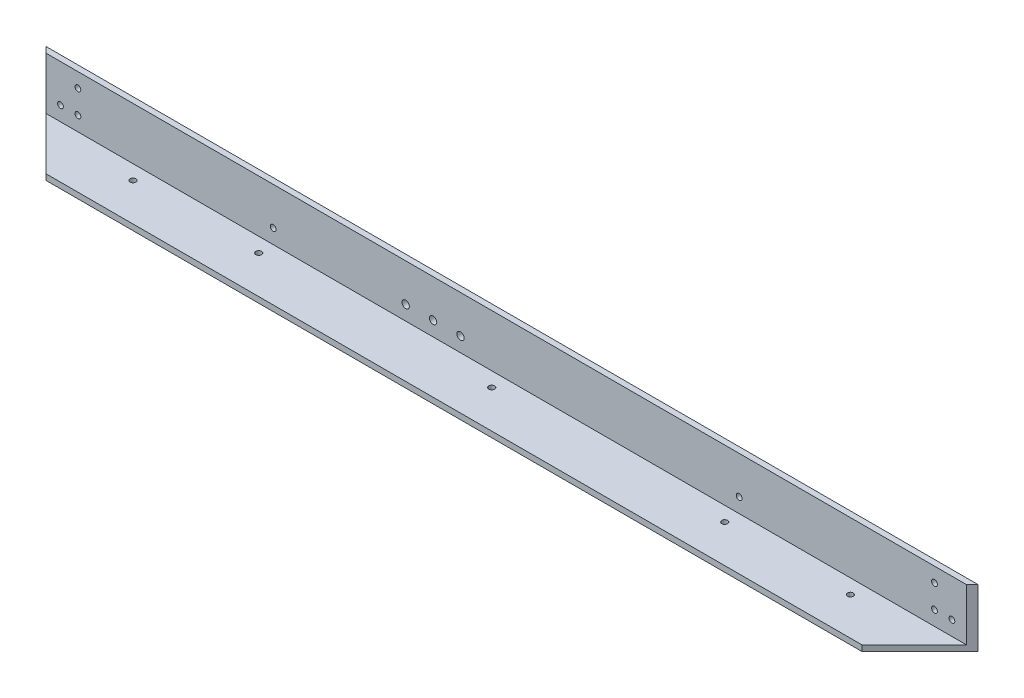
from build123d import *

# Parameters (mm, degrees)
BOSS_EXTRUDE1_DEPTH          = 510
CHAMFER6_SIZE                = 31.75
CHAMFER7_SIZE                = 31.75
TOPHOLES_SKETCH3_R           = 1.5875
TOPHOLES_CUT_EXTRUDE2_DEPTH  = 512.785690622
BACKHOLES_SKETCH4_R          = 1.5875
BACKHOLES_SKETCH4_R_2        = 2
BACKHOLES_CUT_EXTRUDE3_DEPTH = 512.785690622


with BuildPart() as part:
    # Sketch1 → Boss-Extrude1 (new body)
    with BuildSketch(Plane(origin=(0, 0, 0), x_dir=(0, 0, -1), z_dir=(1, 0, 0))):
        Polygon((0, 0), (-31.75, 0), (-31.75, 3.175), (-3.175, 3.175), (-3.175, 31.75), (0, 31.75), align=None)
    extrude(amount=BOSS_EXTRUDE1_DEPTH)

    # Chamfer6
    chamfer6_edges = [part.edges().sort_by_distance(p)[0] for p in [
        (510, 1.5875, 31.75),
    ]]
    chamfer(chamfer6_edges, length=CHAMFER6_SIZE - 0.0001)  # a hair under: the kernel refuses the full size

    # Chamfer7
    chamfer7_edges = [part.edges().sort_by_distance(p)[0] for p in [
        (0, 1.5875, 31.75),
    ]]
    chamfer(chamfer7_edges, length=CHAMFER7_SIZE - 0.0001)  # a hair under: the kernel refuses the full size

    # TopHoles-Sketch3 → TopHoles-Cut-Extrude2 (cut, through all)
    with BuildSketch(Plane(origin=(0, 3.175, 0), x_dir=(1, 0, 0), z_dir=(0, 1, 0))):
        with Locations(Location((451.2625, -11.1125, 0), (0, 0, 270))):
            Circle(TOPHOLES_SKETCH3_R)
        with Locations(Location((58.7375, -11.1125, 0), (0, 0, 270))):
            Circle(TOPHOLES_SKETCH3_R)
        with Locations(Location((127.5, -11.1125, 0), (0, 0, 270))):
            Circle(TOPHOLES_SKETCH3_R)
        with Locations(Location((255, -11.1125, 0), (0, 0, 270))):
            Circle(TOPHOLES_SKETCH3_R)
        with Locations(Location((382.5, -11.1125, 0), (0, 0, 270))):
            Circle(TOPHOLES_SKETCH3_R)
    extrude(amount=-TOPHOLES_CUT_EXTRUDE2_DEPTH, mode=Mode.SUBTRACT)

    # BackHoles-Sketch4 → BackHoles-Cut-Extrude3 (cut, through all)
    with BuildSketch(Plane.XY.offset(3.175)):
        with Locations((489.3625, 23.8125)):
            Circle(BACKHOLES_SKETCH4_R)
        with Locations((20.6375, 23.8125)):
            Circle(BACKHOLES_SKETCH4_R)
        with Locations((11.1125, 11.1125)):
            Circle(BACKHOLES_SKETCH4_R)
        with Locations((20.6375, 11.1125)):
            Circle(BACKHOLES_SKETCH4_R)
        with Locations((489.3625, 11.1125)):
            Circle(BACKHOLES_SKETCH4_R)
        with Locations((498.8875, 11.1125)):
            Circle(BACKHOLES_SKETCH4_R)
        with Locations((200, 11.1125)):
            Circle(BACKHOLES_SKETCH4_R_2)
        with Locations((215, 11.1125)):
            Circle(BACKHOLES_SKETCH4_R_2)
        with Locations((230, 11.1125)):
            Circle(BACKHOLES_SKETCH4_R_2)
        with Locations((127.5, 11.1125)):
            Circle(BACKHOLES_SKETCH4_R)
        with Locations((382.5, 11.1125)):
            Circle(BACKHOLES_SKETCH4_R)
    extrude(amount=-BACKHOLES_CUT_EXTRUDE3_DEPTH, mode=Mode.SUBTRACT)


solid = part.part
